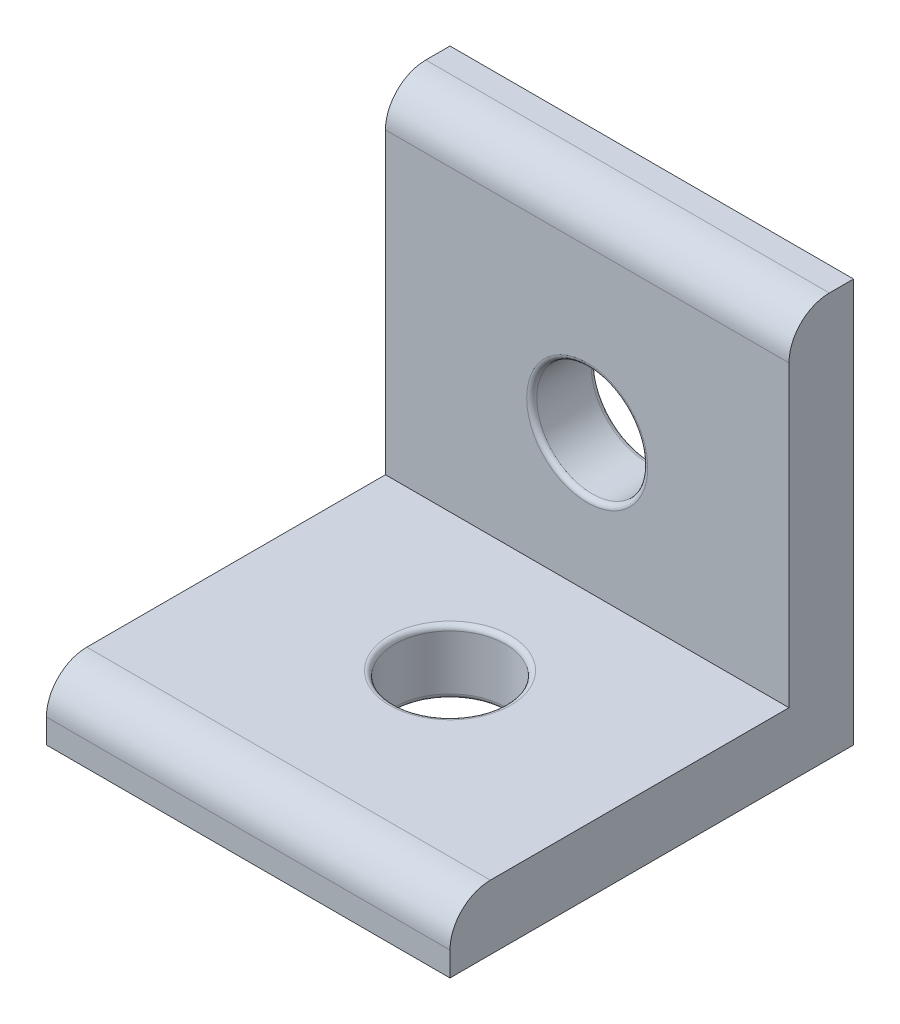
from build123d import *

# Parameters (mm, degrees)
SKETCH1_W           = 20
SKETCH1_H           = 20
BOSS_EXTRUDE1_DEPTH = 3.2
SKETCH2_W           = 20
SKETCH2_H           = 3.2
BOSS_EXTRUDE2_DEPTH = 16.8
SKETCH3_R           = 2.75
CUT_EXTRUDE1_DEPTH  = 22.95996357
SKETCH4_R           = 2.75
CUT_EXTRUDE2_DEPTH  = 28.96855377
FILLET1_R           = 2
FILLET2_R           = 0.25


with BuildPart() as part:
    # Sketch1 → Boss-Extrude1 (new body)
    with BuildSketch(Plane(origin=(0, 0, 0), x_dir=(1, 0, 0), z_dir=(0, 1, 0))):
        Rectangle(SKETCH1_W, SKETCH1_H)
    extrude(amount=BOSS_EXTRUDE1_DEPTH)

    # Sketch2 → Boss-Extrude2 (add)
    with BuildSketch(Plane(origin=(0, 3.2, 0), x_dir=(1, 0, 0), z_dir=(0, 1, 0))):
        with Locations((0, 8.4)):
            Rectangle(SKETCH2_W, SKETCH2_H)
    extrude(amount=BOSS_EXTRUDE2_DEPTH)

    # Sketch3 → Cut-Extrude1 (cut, through all)
    with BuildSketch(Plane(origin=(0, 3.2, 0), x_dir=(1, 0, 0), z_dir=(0, 1, 0))):
        Circle(SKETCH3_R)
    extrude(amount=-CUT_EXTRUDE1_DEPTH, mode=Mode.SUBTRACT)

    # Sketch4 → Cut-Extrude2 (cut, through all)
    with BuildSketch(Plane.XY.offset(-6.8)):
        with Locations((0, 10)):
            Circle(SKETCH4_R)
    extrude(amount=-CUT_EXTRUDE2_DEPTH, mode=Mode.SUBTRACT)

    # Fillet1
    fillet1_edges = [part.edges().sort_by_distance(p)[0] for p in [
        (0, 20, -6.8),
        (0, 3.2, 10),
    ]]
    fillet(fillet1_edges, radius=FILLET1_R)

    # Fillet2
    fillet2_edges = [part.edges().sort_by_distance(p)[0] for p in [
        (-2.75, 10, -6.8),
        (-2.75, 10, -10),
        (-2.75, 3.2, 0),
        (-2.75, 0, 0),
    ]]
    fillet(fillet2_edges, radius=FILLET2_R)


solid = part.part
